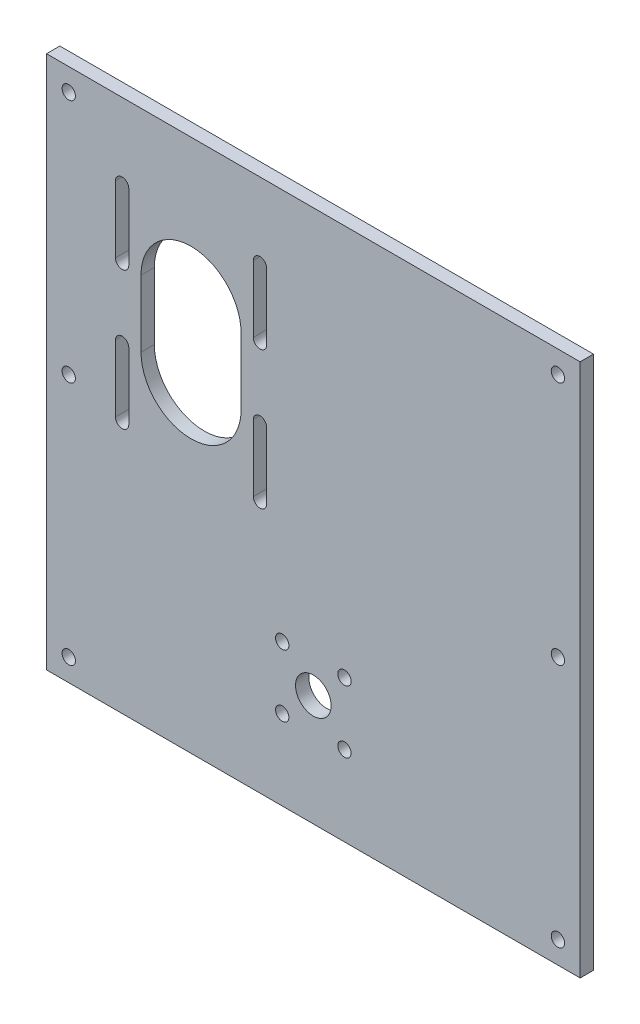
from build123d import *

# Parameters (mm, degrees)
BOSS_EXTRU_1_DEPTH      = 3
ESQUISSE2_R             = 1.5
ENL_V_MAT_EXTRU_2_DEPTH = 3
ESQUISSE3_R             = 4
ESQUISSE3_R_2           = 1.5
ENL_V_MAT_EXTRU_3_DEPTH = 10
ESQUISSE4_W             = 100
ESQUISSE4_H             = 21.457187309
ENL_V_MAT_EXTRU_4_DEPTH = 10


with BuildPart() as part:
    # Esquisse1 → Boss.-Extru.1 (new body)
    with BuildSketch(Plane.XY):
        Polygon((-50, -65), (50, -65), (50, -55), (60, -55), (60, 65), (-60, 65), (-60, -55), (-50, -55), align=None)
        with BuildLine():
            ThreePointArc((-41.5, 2), (-43, 0.5), (-44.5, 2))
            Line((-44.5, 2), (-44.5, 17))
            ThreePointArc((-44.5, 17), (-43, 18.5), (-41.5, 17))
            Line((-41.5, 17), (-41.5, 2))
        make_face(mode=Mode.SUBTRACT)
        with BuildLine():
            Line((-10.5, 17), (-10.5, 2))
            ThreePointArc((-10.5, 2), (-12, 0.5), (-13.5, 2))
            Line((-13.5, 2), (-13.5, 17))
            ThreePointArc((-13.5, 17), (-12, 18.5), (-10.5, 17))
        make_face(mode=Mode.SUBTRACT)
        with BuildLine():
            ThreePointArc((-16.25, 17.5), (-27.5, 6.25), (-38.75, 17.5))
            Line((-38.75, 17.5), (-38.75, 32.5))
            ThreePointArc((-38.75, 32.5), (-27.5, 43.75), (-16.25, 32.5))
            Line((-16.25, 32.5), (-16.25, 17.5))
        make_face(mode=Mode.SUBTRACT)
        with BuildLine():
            ThreePointArc((-41.5, 33), (-43, 31.5), (-44.5, 33))
            Line((-44.5, 33), (-44.5, 48))
            ThreePointArc((-44.5, 48), (-43, 49.5), (-41.5, 48))
            Line((-41.5, 48), (-41.5, 33))
        make_face(mode=Mode.SUBTRACT)
        with BuildLine():
            Line((-10.5, 48), (-10.5, 33))
            ThreePointArc((-10.5, 33), (-12, 31.5), (-13.5, 33))
            Line((-13.5, 33), (-13.5, 48))
            ThreePointArc((-13.5, 48), (-12, 49.5), (-10.5, 48))
        make_face(mode=Mode.SUBTRACT)
    extrude(amount=BOSS_EXTRU_1_DEPTH)

    # Esquisse2 → Enlèv. mat.-Extru.2 (cut)
    with BuildSketch(Plane.XY.offset(3)):
        with Locations((45, -60)):
            Circle(ESQUISSE2_R)
        with Locations((-55, -50)):
            Circle(ESQUISSE2_R)
        with Locations((-55, 5)):
            Circle(ESQUISSE2_R)
        with Locations((-55, 60)):
            Circle(ESQUISSE2_R)
        with Locations((22.5, -60)):
            Circle(ESQUISSE2_R)
        with Locations((0, -60)):
            Circle(ESQUISSE2_R)
        with Locations((-22.5, -60)):
            Circle(ESQUISSE2_R)
        with Locations((-45, -60)):
            Circle(ESQUISSE2_R)
        with Locations((55, -50)):
            Circle(ESQUISSE2_R)
        with Locations((55, 5)):
            Circle(ESQUISSE2_R)
        with Locations((55, 60)):
            Circle(ESQUISSE2_R)
    extrude(amount=-ENL_V_MAT_EXTRU_2_DEPTH, mode=Mode.SUBTRACT)

    # Esquisse3 → Enlèv. mat.-Extru.3 (cut)
    with BuildSketch(Plane.XY.offset(3)):
        with Locations((0, -30)):
            Circle(ESQUISSE3_R)
        with Locations((-7, -23)):
            Circle(ESQUISSE3_R_2)
        with Locations((7, -23)):
            Circle(ESQUISSE3_R_2)
        with Locations((7, -37)):
            Circle(ESQUISSE3_R_2)
        with Locations((-7, -37)):
            Circle(ESQUISSE3_R_2)
    extrude(amount=-ENL_V_MAT_EXTRU_3_DEPTH, mode=Mode.SUBTRACT)

    # Esquisse4 → Enlèv. mat.-Extru.4 (cut)
    with BuildSketch(Plane.XY.offset(3)):
        with Locations((0, -65.728593655)):
            Rectangle(ESQUISSE4_W, ESQUISSE4_H)
    extrude(amount=-ENL_V_MAT_EXTRU_4_DEPTH, mode=Mode.SUBTRACT)


solid = part.part
